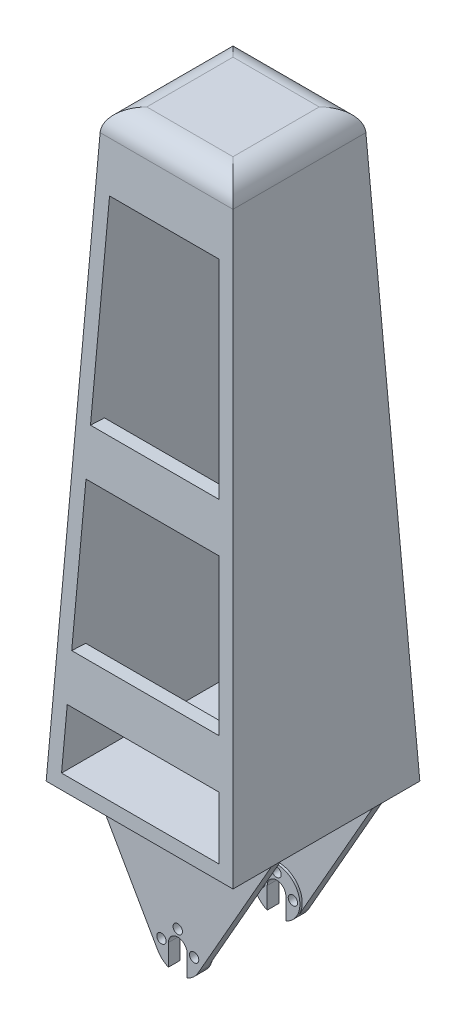
from build123d import *

# Parameters (mm, degrees)
CROQUIS3_W                 = 80
CROQUIS3_H                 = 80
SALIENTE_EXTRUIR2_DEPTH    = 250
SALIENTE_EXTRUIR2_TAPER    = 2.75
VACIADO1_T                 = 6
CORTAR_EXTRUIR6_DEPTH      = 50
CORTAR_EXTRUIR6_DEPTH_BACK = 50
CROQUIS26_W                = 70.014697611
CROQUIS26_H                = 20
CROQUIS26_W_2              = 61.984721231
SALIENTE_EXTRUIR4_DEPTH    = 6
CROQUIS29_W                = 55.983277758
CROQUIS29_H                = 55.983277758
SALIENTE_EXTRUIR5_DEPTH    = 30
SALIENTE_EXTRUIR5_DRAFT    = 2.75
CROQUIS31_R                = 10
SALIENTE_EXTRUIR6_DEPTH    = 5
SALIENTE_EXTRUIR7_DEPTH    = 4
CROQUIS31_3_R              = 4
CROQUIS31_3_R_2            = 2
CORTAR_EXTRUIR10_DEPTH     = 6
CROQUIS33_R                = 10
SALIENTE_EXTRUIR8_DEPTH    = 5
SALIENTE_EXTRUIR9_DEPTH    = 4
CROQUIS33_3_R              = 2
CROQUIS33_3_R_2            = 4
CORTAR_EXTRUIR11_DEPTH     = 6
FILLET2_R                  = 10
CORTAR_EXTRUIR12_START     = -47.3
CROQUIS35_W                = 8
CROQUIS35_H                = 20.741669121
CORTAR_EXTRUIR12_DEPTH     = 47.3


with BuildPart() as part:
    # Croquis3 → Saliente-Extruir2 (new body)
    with BuildSketch(Plane(origin=(0, 0, 0), x_dir=(-1, 0, 0), z_dir=(0, 1, 0))):
        Rectangle(CROQUIS3_W, CROQUIS3_H)
    extrude(amount=SALIENTE_EXTRUIR2_DEPTH, taper=SALIENTE_EXTRUIR2_TAPER)

    # Vaciado1 (no face opened: a closed hollow body)
    add(offset(amount=-VACIADO1_T, mode=Mode.PRIVATE), mode=Mode.SUBTRACT)

    # Croquis24 → Cortar-Extruir6 (cut, two sides: drawn at the far end of the back side and taken through both)
    with BuildSketch(Plane(origin=(0, 0, 0), x_dir=(0, 1, 0), z_dir=(0, 0, 1)).offset(-CORTAR_EXTRUIR6_DEPTH_BACK)):
        Polygon((6, 33.704881686), (6, -33.704881686), (244, -22.272921898), (244, 22.272921898), align=None)
    extrude(amount=CORTAR_EXTRUIR6_DEPTH + CORTAR_EXTRUIR6_DEPTH_BACK, mode=Mode.SUBTRACT)

    # Croquis26 → Saliente-Extruir4 (add)
    with BuildSketch(Plane(origin=(0, 1.91691505, 39.907923967), x_dir=(1, 0, 0), z_dir=(0, 0.04797812852134405, 0.9988483864849507))):
        with Locations((2.523677538, 39.541274251)):
            Rectangle(CROQUIS26_W, CROQUIS26_H)
        with Locations((2.523677538, 123.224992516)):
            Rectangle(CROQUIS26_W_2, CROQUIS26_H)
    saliente_extruir4 = extrude(amount=-SALIENTE_EXTRUIR4_DEPTH)

    # Simetría1: Saliente-Extruir4 across plane
    add(saliente_extruir4.mirror(Plane.XY))


with BuildPart() as saliente_extruir5_tool:
    # Croquis29 → Saliente-Extruir5 (with draft: the straight prism first)
    with BuildSketch(Plane(origin=(0, 250, 0), x_dir=(-1, 0, 0), z_dir=(0, 1, 0))):
        Rectangle(CROQUIS29_W, CROQUIS29_H)
    extrude(amount=-SALIENTE_EXTRUIR5_DEPTH)
    # Saliente-Extruir5: the draft: its side faces are tilted about the plane it starts from
    saliente_extruir5_sides = [saliente_extruir5_tool.faces().sort_by_distance(p)[0] for p in [
        (27.991638879, 235, 0),
        (0, 235, -27.991638879),
        (-27.991638879, 235, 0),
        (0, 235, 27.991638879),
    ]]
    draft(saliente_extruir5_sides, Plane(origin=(0, 250, 0), x_dir=(-1, 0, 0), z_dir=(0, 1, 0)), SALIENTE_EXTRUIR5_DRAFT)


with BuildPart() as part_1:
    add(part.part)

    # Saliente-Extruir5: add saliente_extruir5_tool
    add(saliente_extruir5_tool.part)

    # Fillet2
    # the kernel refuses this fillet: 10 mm, written as the material it takes off along each edge
    with BuildSketch(Plane(origin=(27.991638879, 250, 51.819626298), x_dir=(0.04797812852134406, -0.9988483864849508, 0), z_dir=(0, 0, -1))) as fillet2_piece_1:
        with BuildLine():
            CenterArc((FILLET2_R * 0.953119496773, FILLET2_R), FILLET2_R, 182.75, 87.25)
            Line((-FILLET2_R * 0.0457288897124, FILLET2_R * 0.952021871479), (0, 0))
            Line((0, 0), (FILLET2_R * 0.953119496773, 0))
        make_face()
    extrude(amount=103.639252596, mode=Mode.SUBTRACT)
    with BuildSketch(Plane(origin=(51.819626298, 250, -27.991638879), x_dir=(0, -0.9988483864849508, -0.04797812852134406), z_dir=(-1, 0, 0))) as fillet2_piece_2:
        with BuildLine():
            CenterArc((FILLET2_R * 0.953119496773, FILLET2_R), FILLET2_R, 182.75, 87.25)
            Line((-FILLET2_R * 0.0457288897124, FILLET2_R * 0.952021871479), (0, 0))
            Line((0, 0), (FILLET2_R * 0.953119496773, 0))
        make_face()
    extrude(amount=29.377616399, mode=Mode.SUBTRACT)
    with BuildSketch(Plane(origin=(22.442009899, 250, -27.991638879), x_dir=(0, -0.9988483864849506, -0.04797812852134443), z_dir=(-1, 0, 0))) as fillet2_piece_3:
        with BuildLine():
            CenterArc((9.531194968, 10), FILLET2_R, 182.75, 87.25)
            Line((-0.457288897, 9.520218715), (-1.456137284, 9.472240586))
            Line((-1.456137284, 9.472240586), (-0.953119497, -1))
            Line((-0.953119497, -1), (9.531194968, -1))
            Line((9.531194968, -1), (9.531194968, 0))
        make_face()
    extrude(amount=44.714932797, mode=Mode.SUBTRACT)
    with BuildSketch(Plane(origin=(-22.272922898, 250, -27.991638879), x_dir=(0, -0.9988483864849508, -0.04797812852134406), z_dir=(-1, 0, 0))) as fillet2_piece_4:
        with BuildLine():
            CenterArc((FILLET2_R * 0.953119496773, FILLET2_R), FILLET2_R, 182.75, 87.25)
            Line((-FILLET2_R * 0.0457288897124, FILLET2_R * 0.952021871479), (0, 0))
            Line((0, 0), (FILLET2_R * 0.953119496773, 0))
        make_face()
    extrude(amount=29.5467034, mode=Mode.SUBTRACT)
    with BuildSketch(Plane(origin=(-27.991638879, 250, -51.819626298), x_dir=(1, 0, 0), z_dir=(0, 0, 1))) as fillet2_piece_5:
        with BuildLine():
            CenterArc((FILLET2_R * 0.953119496773, -FILLET2_R), FILLET2_R, 90, 87.25)
            Line((-FILLET2_R * 0.0457288897124, -FILLET2_R * 0.952021871479), (0, 0))
            Line((0, 0), (FILLET2_R * 0.953119496773, 0))
        make_face()
    extrude(amount=103.639252596, mode=Mode.SUBTRACT)
    with BuildSketch(Plane(origin=(-51.819626298, 250, 27.991638879), x_dir=(0, 0, -1), z_dir=(1, 0, 0))) as fillet2_piece_6:
        with BuildLine():
            CenterArc((FILLET2_R * 0.953119496773, -FILLET2_R), FILLET2_R, 90, 87.25)
            Line((-FILLET2_R * 0.0457288897124, -FILLET2_R * 0.952021871479), (0, 0))
            Line((0, 0), (FILLET2_R * 0.953119496773, 0))
        make_face()
    extrude(amount=29.377616399, mode=Mode.SUBTRACT)
    with BuildSketch(Plane(origin=(-22.442009899, 250, 27.991638879), x_dir=(0, 0, -1), z_dir=(1, 0, 0))) as fillet2_piece_7:
        with BuildLine():
            CenterArc((9.531194968, -10), FILLET2_R, 90, 87.25)
            Line((-0.457288897, -9.520218715), (-1.456137284, -9.472240586))
            Line((-1.456137284, -9.472240586), (-0.953119497, 1))
            Line((-0.953119497, 1), (9.531194968, 1))
            Line((9.531194968, 1), (9.531194968, 0))
        make_face()
    extrude(amount=44.714932797, mode=Mode.SUBTRACT)
    with BuildSketch(Plane(origin=(22.272922898, 250, 27.991638879), x_dir=(0, 0, -1), z_dir=(1, 0, 0))) as fillet2_piece_8:
        with BuildLine():
            CenterArc((FILLET2_R * 0.953119496773, -FILLET2_R), FILLET2_R, 90, 87.25)
            Line((-FILLET2_R * 0.0457288897124, -FILLET2_R * 0.952021871479), (0, 0))
            Line((0, 0), (FILLET2_R * 0.953119496773, 0))
        make_face()
    extrude(amount=29.5467034, mode=Mode.SUBTRACT)


with BuildPart() as body_2:
    # Croquis31 → Saliente-Extruir6 (new body)
    with BuildSketch(Plane(origin=(0, 0, 18.65), x_dir=(0, 1, 0), z_dir=(0, 0, 1))):
        with Locations(Location((-50, 0, 0), (0, 0, 270))):
            Circle(CROQUIS31_R)
    extrude(amount=SALIENTE_EXTRUIR6_DEPTH)

    # Croquis32 → Saliente-Extruir7 (add)
    with BuildSketch(Plane.XY.offset(23.65)):
        Polygon((-40, 0), (-8.843447734, -54.678825581), (8.843447734, -54.678825581), (40, 0), align=None)
    extrude(amount=-SALIENTE_EXTRUIR7_DEPTH)

    # Croquis31<3> → Cortar-Extruir10 (cut)
    with BuildSketch(Plane(origin=(0, 0, 18.65), x_dir=(0, 1, 0), z_dir=(0, 0, 1))):
        with Locations(Location((-50, 0, 0), (0, 0, 270))):
            Circle(CROQUIS31_3_R)
        with Locations(Location((-50, 7, 0), (0, 0, 270))):
            Circle(CROQUIS31_3_R_2)
        with Locations(Location((-43, 0, 0), (0, 0, 270))):
            Circle(CROQUIS31_3_R_2)
        with Locations(Location((-50, -7, 0), (0, 0, 270))):
            Circle(CROQUIS31_3_R_2)
        with Locations(Location((-57, 0, 0), (0, 0, 270))):
            Circle(CROQUIS31_3_R_2)
    extrude(amount=CORTAR_EXTRUIR10_DEPTH, mode=Mode.SUBTRACT)


with BuildPart() as body_3:
    # Croquis33 → Saliente-Extruir8 (new body)
    with BuildSketch(Plane(origin=(0, 0, -18.65), x_dir=(0, 1, 0), z_dir=(0, 0, 1))):
        with Locations(Location((-50, 0, 0), (0, 0, 270))):
            Circle(CROQUIS33_R)
    extrude(amount=-SALIENTE_EXTRUIR8_DEPTH)

    # Croquis34 → Saliente-Extruir9 (add)
    with BuildSketch(Plane(origin=(0, 0, -23.65), x_dir=(1, 0, 0), z_dir=(0, 0, -1))):
        Polygon((-8.843447734, 54.678825581), (-40, 0), (40, 0), (8.843447734, 54.678825581), align=None)
    extrude(amount=-SALIENTE_EXTRUIR9_DEPTH)

    # Croquis33<3> → Cortar-Extruir11 (cut)
    with BuildSketch(Plane(origin=(0, 0, -18.65), x_dir=(0, 1, 0), z_dir=(0, 0, 1))):
        with Locations(Location((-43, 0, 0), (0, 0, 270))):
            Circle(CROQUIS33_3_R)
        with Locations(Location((-57, 0, 0), (0, 0, 270))):
            Circle(CROQUIS33_3_R)
        with Locations(Location((-50, -7, 0), (0, 0, 270))):
            Circle(CROQUIS33_3_R)
        with Locations(Location((-50, 7, 0), (0, 0, 270))):
            Circle(CROQUIS33_3_R)
        with Locations(Location((-50, 0, 0), (0, 0, 270))):
            Circle(CROQUIS33_3_R_2)
    extrude(amount=-CORTAR_EXTRUIR11_DEPTH, mode=Mode.SUBTRACT)


with BuildPart() as cortar_extruir12_tool:
    # Croquis35 → Cortar-Extruir12 (new body)
    with BuildSketch(Plane.XY.offset(23.65).offset(CORTAR_EXTRUIR12_START)):
        with Locations((0, -60.370834561)):
            Rectangle(CROQUIS35_W, CROQUIS35_H)
    extrude(amount=CORTAR_EXTRUIR12_DEPTH)


with BuildPart() as body_2_1:
    add(body_2.part)

    # Cortar-Extruir12: cut by cortar_extruir12_tool
    add(cortar_extruir12_tool.part, mode=Mode.SUBTRACT)


with BuildPart() as body_3_1:
    add(body_3.part)

    # Cortar-Extruir12: cut by cortar_extruir12_tool
    add(cortar_extruir12_tool.part, mode=Mode.SUBTRACT)


solid = Compound([part_1.part, body_2_1.part, body_3_1.part])
